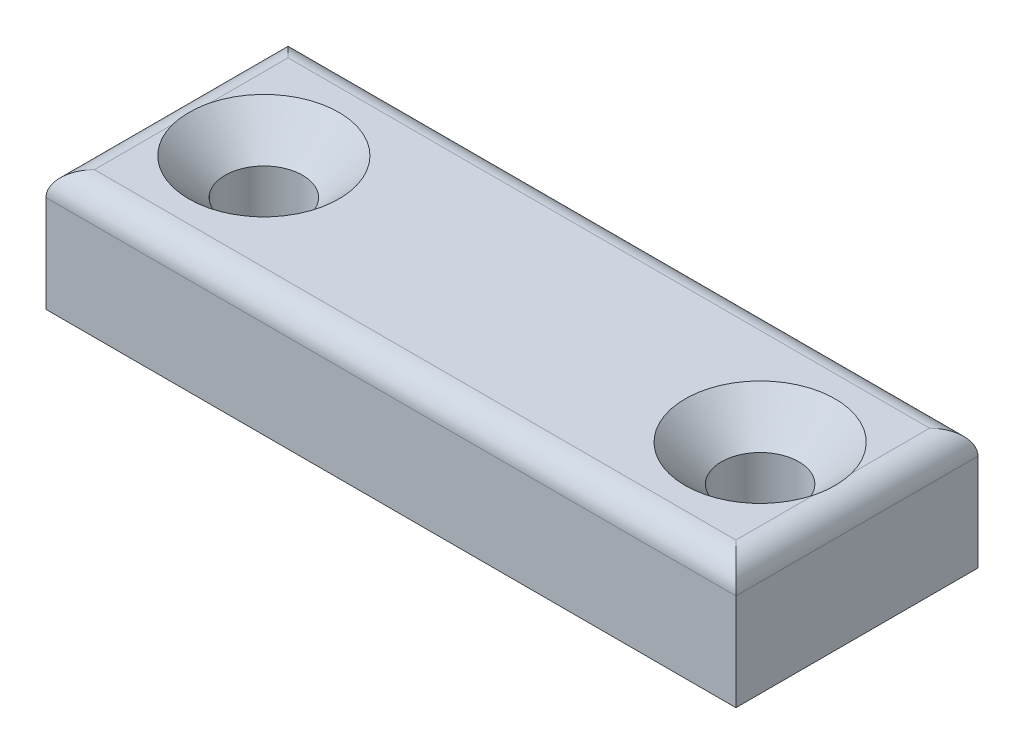
from build123d import *

# Parameters (mm, degrees)
SKETCH1_W           = 28.5
SKETCH1_H           = 10
SKETCH1_R           = 1.6
BOSS_EXTRUDE1_DEPTH = 5
FILLET1_R           = 1
CHAMFER1_SIZE       = 1.5


with BuildPart() as part:
    # Sketch1 → Boss-Extrude1 (new body)
    with BuildSketch(Plane(origin=(0, 0, 0), x_dir=(1, 0, 0), z_dir=(0, 1, 0))):
        with Locations((-14.25, 5)):
            Rectangle(SKETCH1_W, SKETCH1_H)
        with Locations(Location((-4, 5, 0), (0, 0, 270))):
            Circle(SKETCH1_R, mode=Mode.SUBTRACT)
        with Locations(Location((-24.5, 5, 0), (0, 0, 270))):
            Circle(SKETCH1_R, mode=Mode.SUBTRACT)
    extrude(amount=BOSS_EXTRUDE1_DEPTH)

    # Fillet1
    fillet1_edges = [part.edges().sort_by_distance(p)[0] for p in [
        (-28.5, 5, -5),
        (-14.25, 5, 0),
        (0, 5, -5),
        (-14.25, 5, -10),
    ]]
    fillet(fillet1_edges, radius=FILLET1_R)

    # Chamfer1
    # the kernel refuses this chamfer: 1.5 mm, written as the material it takes off along each edge
    with BuildSketch(Plane(origin=(-4, 5, -5), x_dir=(0, 0, 1), z_dir=(-1, 0, 0))) as chamfer1_piece_1:
        Polygon((1.6 + CHAMFER1_SIZE, 0), (1.6, -CHAMFER1_SIZE), (1.6, 0), align=None)
    revolve(axis=Axis((-4, 5, -5), (0, 1, 0)), mode=Mode.SUBTRACT)
    with BuildSketch(Plane(origin=(-24.5, 5, -5), x_dir=(0, 0, 1), z_dir=(-1, 0, 0))) as chamfer1_piece_2:
        Polygon((1.6 + CHAMFER1_SIZE, 0), (1.6, -CHAMFER1_SIZE), (1.6, 0), align=None)
    revolve(axis=Axis((-24.5, 5, -5), (0, 1, 0)), mode=Mode.SUBTRACT)


solid = part.part
